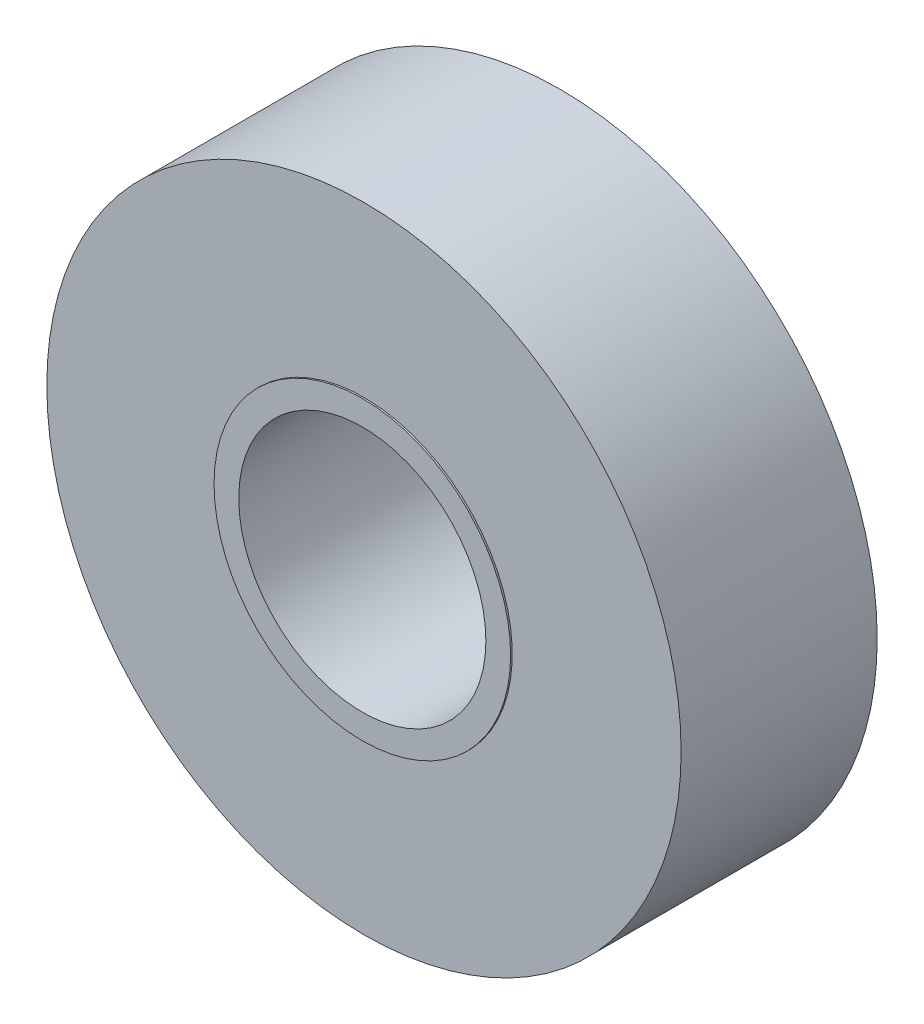
from build123d import *

# Parameters (mm, degrees)
CROQUIS1_R                   = 9
CROQUIS1_R_2                 = 7.5
SALIENTE_EXTRUIR1_DEPTH      = 12
SALIENTE_EXTRUIR2_DEPTH      = 1
SALIENTE_EXTRUIR2_DEPTH_BACK = 0.1
CROQUIS2_R                   = 7.5
CROQUIS3_R                   = 5.2
CROQUIS3_R_2                 = 1.5
SALIENTE_EXTRUIR4_DEPTH      = 3
CROQUIS4_R                   = 19.25
CROQUIS4_R_2                 = 9
SALIENTE_EXTRUIR5_DEPTH      = 11.9


with BuildPart() as part:
    # Croquis1 → Saliente-Extruir1 (new body)
    with BuildSketch(Plane.XY):
        Circle(CROQUIS1_R)
        Circle(CROQUIS1_R_2, mode=Mode.SUBTRACT)
    extrude(amount=SALIENTE_EXTRUIR1_DEPTH)

    # Croquis2 → Saliente-Extruir2 (add, two sides: drawn at the far end of the back side and taken through both)
    with BuildSketch(Plane.XY.offset(-SALIENTE_EXTRUIR2_DEPTH_BACK)):
        Circle(CROQUIS2_R)
    extrude(amount=SALIENTE_EXTRUIR2_DEPTH + SALIENTE_EXTRUIR2_DEPTH_BACK)

    # Croquis3 → Saliente-Extruir4 (add)
    with BuildSketch(Plane.XY):
        Circle(CROQUIS3_R)
        Circle(CROQUIS3_R_2, mode=Mode.SUBTRACT)
    extrude(amount=-SALIENTE_EXTRUIR4_DEPTH)

    # Croquis4 → Saliente-Extruir5 (add)
    with BuildSketch(Plane(origin=(0, 0, 0), x_dir=(-1, 0, 0), z_dir=(0, 0, -1))):
        Circle(CROQUIS4_R)
        Circle(CROQUIS4_R_2, mode=Mode.SUBTRACT)
    extrude(amount=-SALIENTE_EXTRUIR5_DEPTH)


solid = part.part
